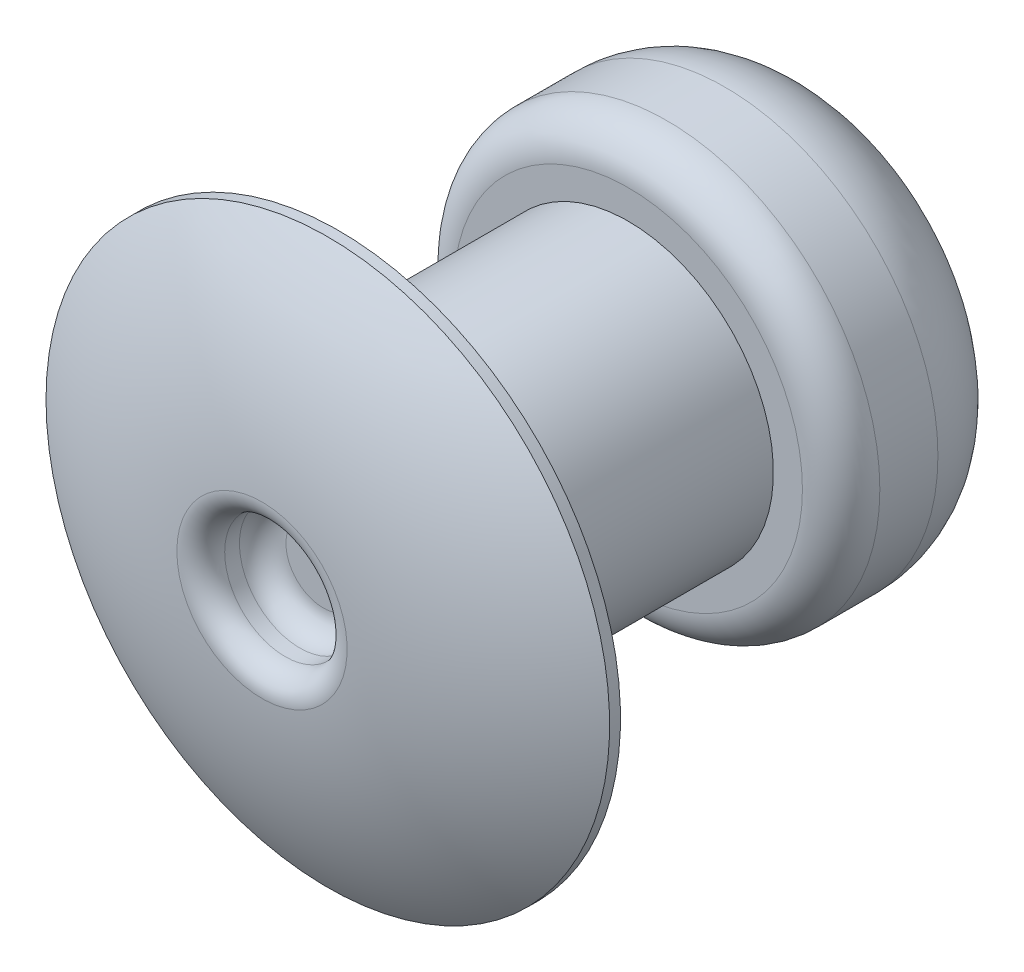
from build123d import *
from OCP.BRepFilletAPI import BRepFilletAPI_MakeFillet

# Parameters (mm, degrees)
SKETCH4_R          = 0.9921875
CUT_EXTRUDE1_DEPTH = 1.016
CUT_EXTRUDE2_START = -2.54
SKETCH3_R          = 0.9921875
CUT_EXTRUDE2_DEPTH = 2.54
FILLET1_R1         = 0.635
FILLET1_R2         = 1.5875
FILLET1_R3         = 0.381


with BuildPart() as part:
    # Sketch2 → Revolve1 (revolve)
    with BuildSketch(Plane(origin=(0, 0, 0), x_dir=(0, 0, -1), z_dir=(1, 0, 0))):
        with BuildLine():
            Line((-1.27, 0.9921875), (-1.27, 0))
            Line((-1.27, 0), (4.7498, 0))
            Line((4.7498, 0), (7.9248, 0))
            Line((7.9248, 0), (7.9248, 3.4925))
            Line((7.9248, 3.4925), (4.7498, 3.4925))
            Line((4.7498, 3.4925), (4.7498, 2.38125))
            Line((4.7498, 2.38125), (0, 2.38125))
            Line((0, 2.38125), (0, 4.6228))
            Line((0, 4.6228), (-0.1778, 4.6228))
            ThreePointArc((-0.1778, 4.6228), (-0.991036966, 2.887856773), (-1.27, 0.9921875))
        make_face()
    revolve(axis=Axis((0, 0, 7.600580616), (0, 0, 1)))

    # Sketch4 → Cut-Extrude1 (cut)
    with BuildSketch(Plane.XY.offset(1.27)):
        Circle(SKETCH4_R)
    extrude(amount=-CUT_EXTRUDE1_DEPTH, mode=Mode.SUBTRACT)

    # Sketch3 → Cut-Extrude2 (cut)
    with BuildSketch(Plane(origin=(0, 0, -7.9248), x_dir=(-1, 0, 0), z_dir=(0, 0, -1)).offset(CUT_EXTRUDE2_START)):
        Circle(SKETCH3_R)
    extrude(amount=CUT_EXTRUDE2_DEPTH, mode=Mode.SUBTRACT)

    # Fillet1: one fillet with a radius per group of edges: ONE call of the kernel's fillet builder (fillet() takes one radius for all edges)
    fillet1_edges_1 = [part.edges().sort_by_distance(p)[0] for p in [
        (0, -3.4925, -4.7498),
    ]]
    fillet1_edges_2 = [part.edges().sort_by_distance(p)[0] for p in [
        (0, -3.4925, -7.9248),
    ]]
    fillet1_edges_3 = [part.edges().sort_by_distance(p)[0] for p in [
        (0, -2.38125, 0),
        (-0.701582509, -0.701582509, 1.27),
        (-0.9921875, 0, 0.254),
    ]]
    fillet1 = BRepFilletAPI_MakeFillet(part.part.solid().wrapped)
    for e in fillet1_edges_1:
        fillet1.Add(FILLET1_R1, e.wrapped)
    for e in fillet1_edges_2:
        fillet1.Add(FILLET1_R2, e.wrapped)
    for e in fillet1_edges_3:
        fillet1.Add(FILLET1_R3, e.wrapped)
    add(Compound.cast(fillet1.Shape()), mode=Mode.REPLACE)


solid = part.part
